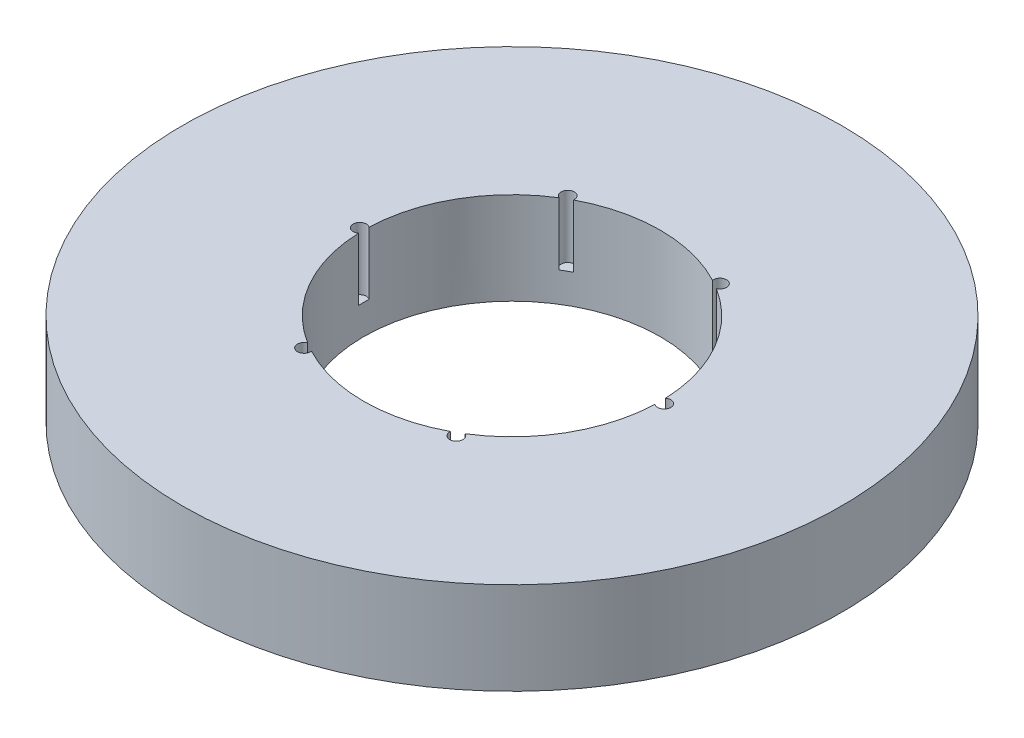
from build123d import *

# Parameters (mm, degrees)
SKETCH1_R           = 100
BOSS_EXTRUDE1_DEPTH = 28
SKETCH2_R           = 45
CUT_EXTRUDE1_DEPTH  = 145.166570328
SKETCH3_R           = 2.010618309
CUT_EXTRUDE2_DEPTH  = 18.992484366
CIRPATTERN1_COUNT   = 6


with BuildPart() as part:
    # Sketch1 → Boss-Extrude1 (new body)
    with BuildSketch(Plane(origin=(0, 0, 0), x_dir=(1, 0, 0), z_dir=(0, 1, 0))):
        Circle(SKETCH1_R)
    extrude(amount=BOSS_EXTRUDE1_DEPTH)

    # Sketch2 → Cut-Extrude1 (cut, through all)
    with BuildSketch(Plane(origin=(0, 0, 0), x_dir=(1, 0, 0), z_dir=(0, 1, 0))):
        Circle(SKETCH2_R)
    extrude(amount=CUT_EXTRUDE1_DEPTH, mode=Mode.SUBTRACT)

    # Sketch3 → Cut-Extrude2 (cut)
    with BuildSketch(Plane(origin=(0, 28, 0), x_dir=(1, 0, 0), z_dir=(0, 1, 0))):
        with Locations((-46.194361215, 0)):
            Circle(SKETCH3_R)
    cut_extrude2 = extrude(amount=-CUT_EXTRUDE2_DEPTH, mode=Mode.SUBTRACT)

    # CirPattern1: Cut-Extrude2 ×6 about axis
    cirpattern1_axis = Axis((0, 0, 0), (0, 1, 0))
    for i in range(1, CIRPATTERN1_COUNT):
        add(cut_extrude2.rotate(cirpattern1_axis, i * 360 / CIRPATTERN1_COUNT), mode=Mode.SUBTRACT)


solid = part.part
